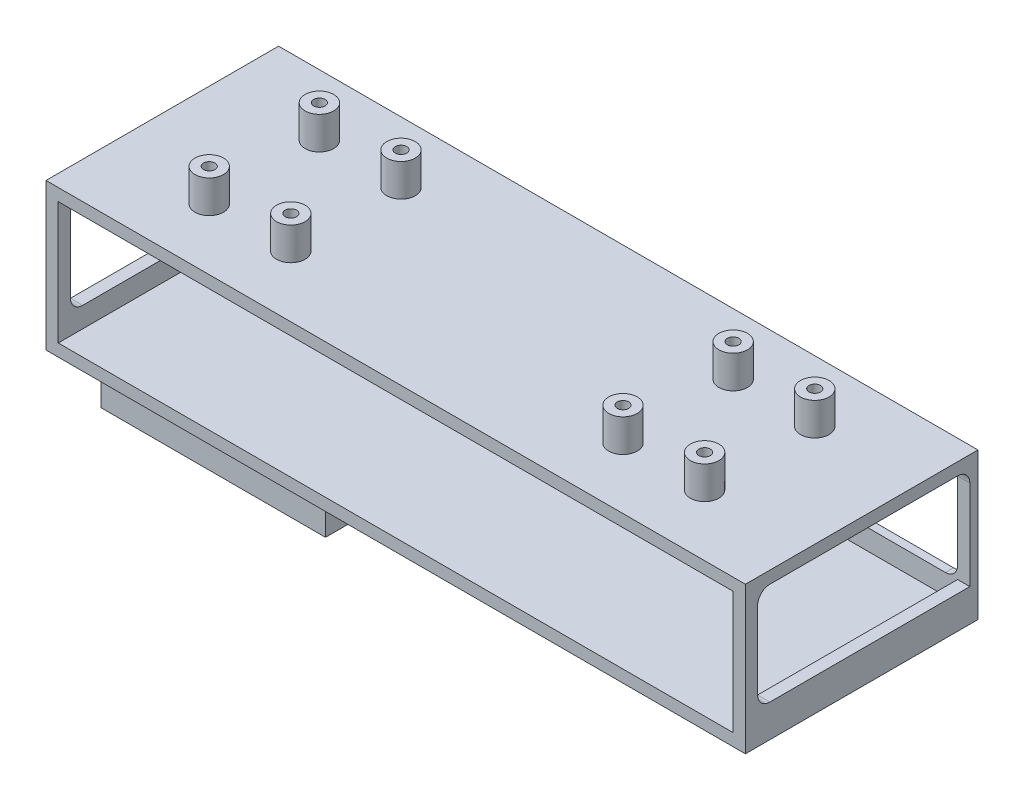
from build123d import *

# Parameters (mm, degrees)
SKETCH1_W           = 171.4
SKETCH1_H           = 57
BOSS_EXTRUDE1_DEPTH = 3
BOSS_EXTRUDE2_DEPTH = 30
SKETCH3_W           = 52
SKETCH3_H           = 25
CUT_EXTRUDE1_DEPTH  = 192
SKETCH4_W           = 171.4
SKETCH4_H           = 57
BOSS_EXTRUDE3_DEPTH = 3
SKETCH5_R           = 3.5
BOSS_EXTRUDE4_DEPTH = 8
SKETCH6_R           = 1.4
CUT_EXTRUDE2_DEPTH  = 6
SKETCH8_W           = 165.4
SKETCH8_H           = 25
CUT_EXTRUDE3_DEPTH  = 6
FILLET2_START       = -85.7
FILLET2_DEPTH       = 3
FILLET2_START_2     = 82.7
FILLET2_2_DEPTH     = 3
FILLET2_START_3     = -28.5
FILLET2_3_DEPTH     = 5
FILLET2_4_DEPTH     = 2
FILLET2_START_4     = -82.7
FILLET2_5_DEPTH     = 165.4
SKETCH9_W           = 55
SKETCH9_H           = 30
BOSS_EXTRUDE5_DEPTH = 19
SKETCH10_W          = 26
SKETCH10_H          = 17
CUT_EXTRUDE4_DEPTH  = 53


with BuildPart() as part:
    # Sketch1 → Boss-Extrude1 (new body)
    with BuildSketch(Plane(origin=(0, 0, 0), x_dir=(1, 0, 0), z_dir=(0, 1, 0))):
        Rectangle(SKETCH1_W, SKETCH1_H)
    extrude(amount=BOSS_EXTRUDE1_DEPTH)

    # Sketch2 → Boss-Extrude2 (add)
    with BuildSketch(Plane(origin=(0, 3, 0), x_dir=(1, 0, 0), z_dir=(0, 1, 0))):
        Polygon((-85.7, -28.5), (-82.7, -28.5), (-82.7, 26.5), (82.7, 26.5), (82.7, -28.5), (85.7, -28.5), (85.7, 28.5), (-85.7, 28.5), align=None)
    extrude(amount=BOSS_EXTRUDE2_DEPTH)

    # Sketch3 → Cut-Extrude1 (cut)
    with BuildSketch(Plane.ZY.offset(85.7)):
        with Locations((-0.5, 20.5)):
            Rectangle(SKETCH3_W, SKETCH3_H)
    extrude(amount=-CUT_EXTRUDE1_DEPTH, mode=Mode.SUBTRACT)

    # Sketch4 → Boss-Extrude3 (add)
    with BuildSketch(Plane(origin=(0, 33, 0), x_dir=(1, 0, 0), z_dir=(0, 1, 0))):
        Rectangle(SKETCH4_W, SKETCH4_H)
    extrude(amount=BOSS_EXTRUDE3_DEPTH)

    # Sketch5 → Boss-Extrude4 (add)
    with BuildSketch(Plane(origin=(0, 36, 0), x_dir=(1, 0, 0), z_dir=(0, 1, 0))):
        with Locations(Location((-60.7, 13.5, 0), (0, 0, 90))):
            Circle(SKETCH5_R)
        with Locations(Location((-40.7, 13.5, 0), (0, 0, 90))):
            Circle(SKETCH5_R)
        with Locations(Location((-40.7, -13.5, 0), (0, 0, 90))):
            Circle(SKETCH5_R)
        with Locations(Location((-60.7, -13.5, 0), (0, 0, 90))):
            Circle(SKETCH5_R)
        with Locations(Location((60.7, -13.5, 0), (0, 0, 90))):
            Circle(SKETCH5_R)
        with Locations(Location((40.7, -13.5, 0), (0, 0, 90))):
            Circle(SKETCH5_R)
        with Locations(Location((40.7, 13.5, 0), (0, 0, 90))):
            Circle(SKETCH5_R)
        with Locations(Location((60.7, 13.5, 0), (0, 0, 90))):
            Circle(SKETCH5_R)
    extrude(amount=BOSS_EXTRUDE4_DEPTH)

    # Sketch6 → Cut-Extrude2 (cut)
    with BuildSketch(Plane(origin=(0, 44, 0), x_dir=(1, 0, 0), z_dir=(0, 1, 0))):
        with Locations(Location((-60.7, 13.5, 0), (0, 0, 270))):
            Circle(SKETCH6_R)
        with Locations(Location((-40.7, 13.5, 0), (0, 0, 270))):
            Circle(SKETCH6_R)
        with Locations(Location((-40.7, -13.5, 0), (0, 0, 90))):
            Circle(SKETCH6_R)
        with Locations(Location((-60.7, -13.5, 0), (0, 0, 90))):
            Circle(SKETCH6_R)
        with Locations(Location((60.7, -13.5, 0), (0, 0, 270))):
            Circle(SKETCH6_R)
        with Locations(Location((40.7, -13.5, 0), (0, 0, 270))):
            Circle(SKETCH6_R)
        with Locations(Location((40.7, 13.5, 0), (0, 0, 90))):
            Circle(SKETCH6_R)
        with Locations(Location((60.7, 13.5, 0), (0, 0, 90))):
            Circle(SKETCH6_R)
    extrude(amount=-CUT_EXTRUDE2_DEPTH, mode=Mode.SUBTRACT)

    # Sketch8 → Cut-Extrude3 (cut)
    with BuildSketch(Plane(origin=(0, 0, -28.5), x_dir=(-1, 0, 0), z_dir=(0, 0, -1))):
        with Locations((0, 20.5)):
            Rectangle(SKETCH8_W, SKETCH8_H)
    extrude(amount=-CUT_EXTRUDE3_DEPTH, mode=Mode.SUBTRACT)

    # Fillet2: read off the stored shape, not the designer's step
    # Fillet2 outline → Fillet2 (add)
    with BuildSketch(Plane.YZ.offset(FILLET2_START)):
        with BuildLine():
            ThreePointArc((33, -23.5), (32.121320344, -25.621320344), (30, -26.5))
            Line((30, -26.5), (33, -26.5))
            Line((33, -26.5), (33, -23.5))
        make_face()
        with BuildLine():
            ThreePointArc((30, 25.5), (32.121320344, 24.621320344), (33, 22.5))
            Line((33, 22.5), (33, 25.5))
            Line((33, 25.5), (30, 25.5))
        make_face()
        with BuildLine():
            Line((8, 25.5), (8, 22.5))
            ThreePointArc((8, 22.5), (8.878679656, 24.621320344), (11, 25.5))
            Line((11, 25.5), (8, 25.5))
        make_face()
    extrude(amount=FILLET2_DEPTH)

    # Fillet2 2 outline → Fillet2 2 (add)
    with BuildSketch(Plane.YZ.offset(FILLET2_START_2)):
        with BuildLine():
            ThreePointArc((33, -23.5), (32.121320344, -25.621320344), (30, -26.5))
            Line((30, -26.5), (33, -26.5))
            Line((33, -26.5), (33, -23.5))
        make_face()
        with BuildLine():
            ThreePointArc((30, 25.5), (32.121320344, 24.621320344), (33, 22.5))
            Line((33, 22.5), (33, 25.5))
            Line((33, 25.5), (30, 25.5))
        make_face()
        with BuildLine():
            Line((8, 25.5), (8, 22.5))
            ThreePointArc((8, 22.5), (8.878679656, 24.621320344), (11, 25.5))
            Line((11, 25.5), (8, 25.5))
        make_face()
    extrude(amount=FILLET2_2_DEPTH)

    # Fillet2 3 outline → Fillet2 3 (add)
    with BuildSketch(Plane.XY.offset(FILLET2_START_3)):
        with BuildLine():
            Line((82.7, 33), (79.7, 33))
            ThreePointArc((79.7, 33), (81.821320344, 32.121320344), (82.7, 30))
            Line((82.7, 30), (82.7, 33))
        make_face()
        with BuildLine():
            ThreePointArc((-82.7, 30), (-81.821320344, 32.121320344), (-79.7, 33))
            Line((-79.7, 33), (-82.7, 33))
            Line((-82.7, 33), (-82.7, 30))
        make_face()
    extrude(amount=FILLET2_3_DEPTH)

    # Fillet2 4 outline → Fillet2 4 (add)
    with BuildSketch(Plane.XY.offset(FILLET2_START_3)):
        with BuildLine():
            Line((82.7, 8), (82.7, 11))
            ThreePointArc((82.7, 11), (81.821320344, 8.878679656), (79.7, 8))
            Line((79.7, 8), (82.7, 8))
        make_face()
        with BuildLine():
            ThreePointArc((-79.7, 8), (-81.821320344, 8.878679656), (-82.7, 11))
            Line((-82.7, 11), (-82.7, 8))
            Line((-82.7, 8), (-79.7, 8))
        make_face()
    extrude(amount=FILLET2_4_DEPTH)

    # Fillet2 5 outline → Fillet2 5 (cut)
    with BuildSketch(Plane.YZ.offset(FILLET2_START_4)):
        with BuildLine():
            Line((30, -23.5), (30, -26.5))
            ThreePointArc((30, -26.5), (32.121320344, -25.621320344), (33, -23.5))
            Line((33, -23.5), (30, -23.5))
        make_face()
    extrude(amount=FILLET2_5_DEPTH, mode=Mode.SUBTRACT)

    # Sketch9 → Boss-Extrude5 (add)
    with BuildSketch(Plane.XZ):
        with Locations((-58.2, 0)):
            Rectangle(SKETCH9_W, SKETCH9_H)
    extrude(amount=BOSS_EXTRUDE5_DEPTH)

    # Sketch10 → Cut-Extrude4 (cut)
    with BuildSketch(Plane.ZY.offset(85.7)):
        with Locations((0, -8.5)):
            Rectangle(SKETCH10_W, SKETCH10_H)
    extrude(amount=-CUT_EXTRUDE4_DEPTH, mode=Mode.SUBTRACT)


solid = part.part
